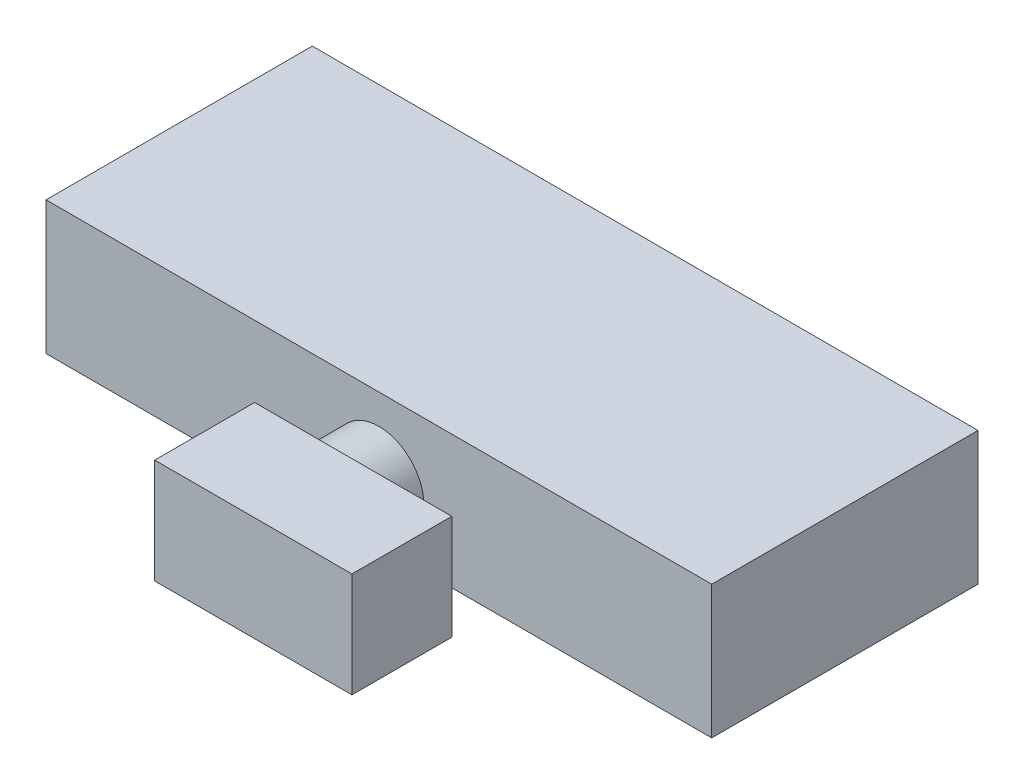
from build123d import *

# Parameters (mm, degrees)
SKETCH2_W           = 254
SKETCH2_H           = 101.6
BOSS_EXTRUDE1_DEPTH = 50.8
SKETCH3_R           = 17.140791438
BOSS_EXTRUDE2_DEPTH = 19.05
SKETCH4_W           = 75.235944222
SKETCH4_H           = 39.955088207
BOSS_EXTRUDE3_DEPTH = 38.1
SCALE2_SCALE        = 0.06
ROTATE_ANGLE        = 90
SCALE5_SCALE        = 0.25
SCALE6_SCALE        = 0.25


with BuildPart() as part:
    # Sketch2 → Boss-Extrude1 (new body)
    with BuildSketch(Plane.XY):
        with Locations((79.130769231, -29.551923077)):
            Rectangle(SKETCH2_W, SKETCH2_H)
    extrude(amount=BOSS_EXTRUDE1_DEPTH)

    # Sketch3 → Boss-Extrude2 (add)
    with BuildSketch(Plane(origin=(0, 21.248076923, 0), x_dir=(1, 0, 0), z_dir=(0, 1, 0))):
        with Locations((79.130769231, -28.483063876)):
            Circle(SKETCH3_R)
    extrude(amount=BOSS_EXTRUDE2_DEPTH)

    # Sketch4 → Boss-Extrude3 (add)
    with BuildSketch(Plane(origin=(0, 40.298076923, 0), x_dir=(1, 0, 0), z_dir=(0, 1, 0))):
        with Locations((88.38546847, -28.088530296)):
            Rectangle(SKETCH4_W, SKETCH4_H)
    extrude(amount=BOSS_EXTRUDE3_DEPTH)


with BuildPart() as part_1:
    # Scale2: scaled about (79.865273787, -21.76127862, 25.650943099)
    add(part.part.scale(SCALE2_SCALE).moved(Location((75.07335736, -20.455601903, 24.111886513))))


with BuildPart() as part_2:
    # rotate: moved
    add(part_1.part.rotate(Axis((0, 33.666927966, 26.550068274), (1, 0, 0)), ROTATE_ANGLE))


with BuildPart() as part_3:
    # Scale5: scaled about (79.865273787, 34.566053141, -28.878138312)
    add(part_2.part.scale(SCALE5_SCALE).moved(Location((59.89895534, 25.924539856, -21.658603734))))


with BuildPart() as part_4:
    # Move Body 4 x: moved
    add(part_3.part.moved(Location((-101.6, 0, 0))))


with BuildPart() as part_5:
    # Move Body 2 y: moved
    add(part_4.part.moved(Location((0, -50.8, 0))))


with BuildPart() as part_6:
    # Scale6: scaled about (-21.734726213, -16.233946859, -28.878138312)
    add(part_5.part.scale(SCALE6_SCALE).moved(Location((-16.30104466, -12.175460144, -21.658603734))))


with BuildPart() as part_7:
    # Move Body 2.1z: moved
    add(part_6.part.moved(Location((0, 0, -53.34))))


solid = part_7.part
